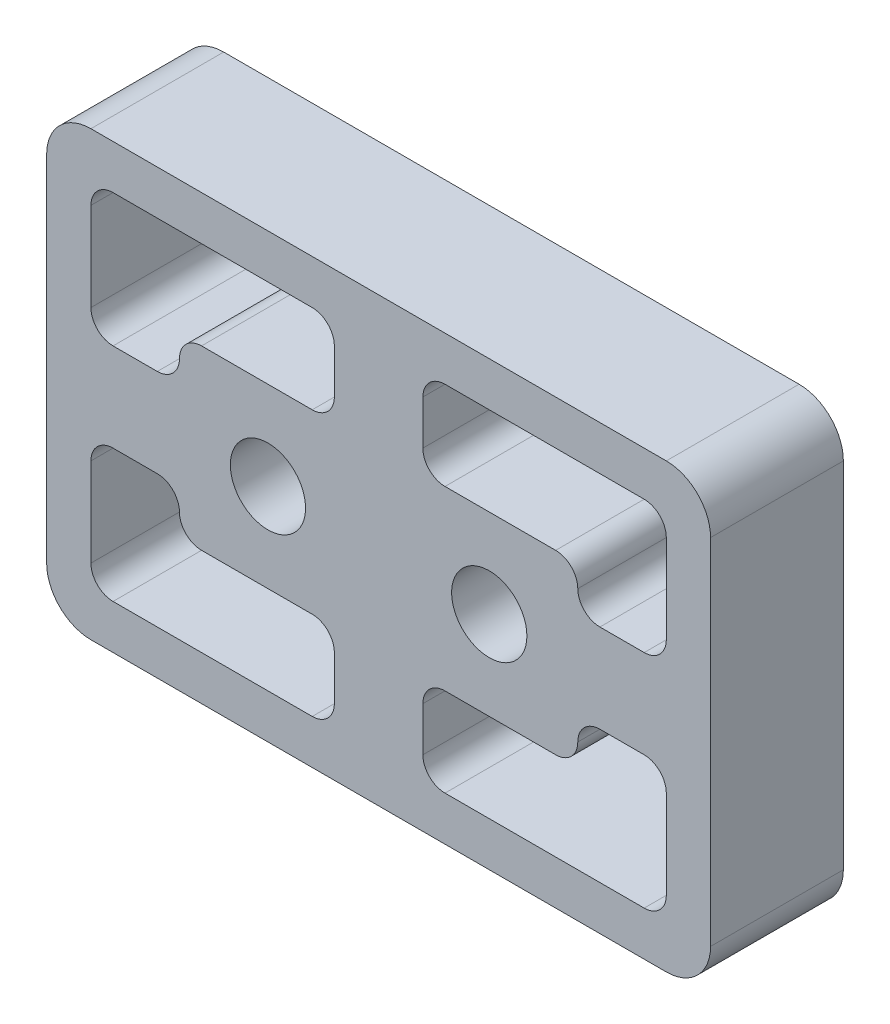
from build123d import *

# Parameters (mm, degrees)
SKETCH_1_W          = 30
SKETCH_1_H          = 20
EXTRUDE_1_DEPTH     = 6
FILLET_1_R          = 2
SKETCH_2_R          = 1.7
CUT_EXTRUDE_1_DEPTH = 20
CUT_EXTRUDE_2_DEPTH = 20
FILLET_2_R          = 1


with BuildPart() as part:
    # 草图1 → 凸台-拉伸1 (new body)
    with BuildSketch(Plane.XY):
        Rectangle(SKETCH_1_W, SKETCH_1_H)
    extrude(amount=EXTRUDE_1_DEPTH)

    # 圆角1
    fillet_1_edges = [part.edges().sort_by_distance(p)[0] for p in [
        (15, -10, 3),
        (-15, -10, 3),
        (-15, 10, 3),
        (15, 10, 3),
    ]]
    fillet(fillet_1_edges, radius=FILLET_1_R)

    # 草图2 → 切除-拉伸1 (cut, through all)
    with BuildSketch(Plane.XY.offset(6)):
        with Locations((5, 0)):
            Circle(SKETCH_2_R)
        with Locations(Location((-5, 0, 0), (0, 0, 180))):
            Circle(SKETCH_2_R)
    extrude(amount=-CUT_EXTRUDE_1_DEPTH, mode=Mode.SUBTRACT)

    # 草图3 → 切除-拉伸2 (cut, through all)
    with BuildSketch(Plane.XY.offset(6)):
        Polygon((-13, 2), (-13, 8), (-2, 8), (-2, 4), (-9, 4), (-9, 2), align=None)
        Polygon((9, 2), (13, 2), (13, 8), (2, 8), (2, 4), (9, 4), align=None)
        Polygon((13, -2), (13, -8), (2, -8), (2, -4), (9, -4), (9, -2), align=None)
        Polygon((-9, -2), (-13, -2), (-13, -8), (-2, -8), (-2, -4), (-9, -4), align=None)
    extrude(amount=-CUT_EXTRUDE_2_DEPTH, mode=Mode.SUBTRACT)

    # 圆角2
    fillet_2_edges = [part.edges().sort_by_distance(p)[0] for p in [
        (-2, -4, 3),
        (2, 8, 3),
        (13, 8, 3),
        (13, 2, 3),
        (2, 4, 3),
        (9, 2, 3),
        (9, 4, 3),
        (13, -2, 3),
        (2, -8, 3),
        (2, -4, 3),
        (9, -2, 3),
        (9, -4, 3),
        (13, -8, 3),
        (-2, -8, 3),
        (-13, -8, 3),
        (-13, -2, 3),
        (-9, -2, 3),
        (-9, -4, 3),
        (-2, 8, 3),
        (-2, 4, 3),
        (-9, 4, 3),
        (-9, 2, 3),
        (-13, 2, 3),
        (-13, 8, 3),
    ]]
    fillet(fillet_2_edges, radius=FILLET_2_R - 0.0001)  # a hair under: the kernel refuses the full size


solid = part.part
